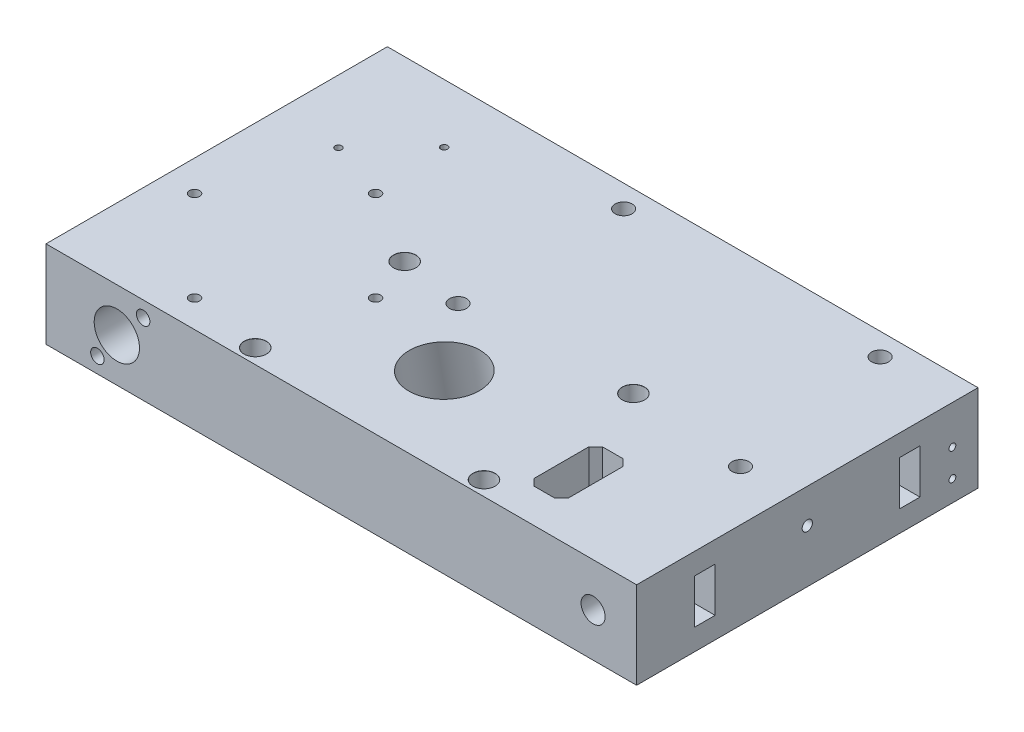
from build123d import *

# Parameters (mm, degrees)
BOSS_EXTRUDE1_DEPTH           = 12.75
BOSS_EXTRUDE1_DEPTH_BACK      = 12.75
SKETCH1_W                     = 165
SKETCH1_H                     = 100
SKETCH5_W                     = 6
SKETCH5_H                     = 13
CUT_EXTRUDE3_DEPTH            = 19.25
SKETCH6_R                     = 10.25
CUT_EXTRUDE4_DEPTH            = 105.029133509
SKETCH11_R                    = 1.5
CUT_EXTRUDE6_DEPTH            = 5
SKETCH2_R                     = 6.63
SKETCH2_R_2                   = 3.525
SKETCH2_R_3                   = 1.975
CUT_EXTRUDE7_DEPTH            = 131.264394598
SKETCH3_R                     = 2.5
CUT_EXTRUDE8_DEPTH            = 5
SKETCH12_R                    = 0.985
CUT_EXTRUDE9_DEPTH            = 5
MOVE_START                    = -12.75
MOVE_FACE1_DEPTH              = 25.5
MOVE_FACE1_2_DEPTH            = 20.5
SKETCH13_W                    = 10
SKETCH13_H                    = 20
CUT_EXTRUDE10_DEPTH           = 107.491783721
CHAMFER1_SIZE                 = 2
SKETCH14_R                    = 1.5
CUT_EXTRUDE11_DEPTH           = 5
CUT_EXTRUDE12_START           = -5
SKETCH15_R                    = 1.5
CUT_EXTRUDE12_DEPTH           = 5
CUT_EXTRUDE15_START           = -25.5
SKETCH17_R                    = 1.5
CUT_EXTRUDE15_DEPTH           = 132.991783721
SKETCH18_R                    = 1.475
SKETCH18_R_2                  = 1.5
CUT_EXTRUDE16_DEPTH           = 5
SKETCH16_R                    = 1
CUT_EXTRUDE13_DEPTH           = 10
CBORE_FOR_M3_SHCS1_AT_2_COUNT = 2
CBORE_FOR_M3_SHCS1_AT_2_PITCH = 43.77
CBORE_FOR_M3_SHCS1_AT_3_COUNT = 2
CBORE_FOR_M3_SHCS1_AT_3_PITCH = 80.030074972
CBORE_FOR_M3_SHCS1_AT_4_COUNT = 2
CBORE_FOR_M3_SHCS1_AT_4_PITCH = 67


# Read off the part's stored shape, not the designer's step: Move Face1
with BuildPart() as part:
    # Sketch1 → Boss-Extrude1 (new, two sides: drawn at the far end of the back side and taken through both)
    with BuildSketch(Plane(origin=(0, 0, 0), x_dir=(1, 0, 0), z_dir=(0, 1, 0)).offset(-BOSS_EXTRUDE1_DEPTH_BACK)):
        Rectangle(SKETCH1_W, SKETCH1_H)
    extrude(amount=BOSS_EXTRUDE1_DEPTH + BOSS_EXTRUDE1_DEPTH_BACK)

    # Sketch5 → Cut-Extrude3 (cut)
    with BuildSketch(Plane(origin=(82.5, 0, 0), x_dir=(0, 0, -1), z_dir=(1, 0, 0))):
        with Locations((-30, 0)):
            Rectangle(SKETCH5_W, SKETCH5_H)
        with Locations((30, 0)):
            Rectangle(SKETCH5_W, SKETCH5_H)
    extrude(amount=-CUT_EXTRUDE3_DEPTH, mode=Mode.SUBTRACT)

    # Sketch6 → Cut-Extrude4 (cut, through all)
    with BuildSketch(Plane(origin=(0, 20.916044041, 3.688062894), x_dir=(1, 0, 0), z_dir=(0, 0.984807753012208, 0.17364817766693072))):
        with Locations(Location((0, -21.249093385, 0), (0, 0, 270))):
            Circle(SKETCH6_R)
    extrude(amount=-CUT_EXTRUDE4_DEPTH, mode=Mode.SUBTRACT)

    # Sketch11 → Cut-Extrude6 (cut)
    with BuildSketch(Plane(origin=(0, 12.75, 0), x_dir=(1, 0, 0), z_dir=(0, 1, 0))):
        with Locations(Location((-28.466991411, -15.483495706, 0), (0, 0, 270))):
            Circle(SKETCH11_R)
        with Locations(Location((-54.983495706, -42, 0), (0, 0, 270))):
            Circle(SKETCH11_R)
        with Locations(Location((-54.983495706, 11.033008589, 0), (0, 0, 90))):
            Circle(SKETCH11_R)
        with Locations((-81.5, -15.483495706)):
            Circle(SKETCH11_R)
    extrude(amount=-CUT_EXTRUDE6_DEPTH, mode=Mode.SUBTRACT)

    # Sketch2 → Cut-Extrude7 (cut, through all)
    with BuildSketch(Plane.XY.offset(50)):
        with Locations((-69.75, 0)):
            Circle(SKETCH2_R)
        with Locations((69.75, 0)):
            Circle(SKETCH2_R_2)
        with Locations(Location((-75.45, -8.2, 0), (0, 0, 180))):
            Circle(SKETCH2_R_3)
        with Locations(Location((-62.05, 8.2, 0), (0, 0, 180))):
            Circle(SKETCH2_R_3)
    extrude(amount=-CUT_EXTRUDE7_DEPTH, mode=Mode.SUBTRACT)

    # Sketch3 → Cut-Extrude8 (cut)
    with BuildSketch(Plane(origin=(0, 12.75, 0), x_dir=(1, 0, 0), z_dir=(0, 1, 0))):
        with Locations(Location((-15, -4.8, 0), (0, 0, 270))):
            Circle(SKETCH3_R)
        with Locations(Location((67.72, -4.8, 0), (0, 0, 270))):
            Circle(SKETCH3_R)
        with Locations(Location((60.37, 43.46, 0), (0, 0, 270))):
            Circle(SKETCH3_R)
        with Locations(Location((-14.76, 43.46, 0), (0, 0, 270))):
            Circle(SKETCH3_R)
    extrude(amount=-CUT_EXTRUDE8_DEPTH, mode=Mode.SUBTRACT)

    # Sketch12 → Cut-Extrude9 (cut)
    with BuildSketch(Plane(origin=(0, 12.75, 0), x_dir=(1, 0, 0), z_dir=(0, 1, 0))):
        with Locations(Location((-56.672, 32.8, 0), (0, 0, 270))):
            Circle(SKETCH12_R)
        with Locations(Location((-72.039, 17.2, 0), (0, 0, 270))):
            Circle(SKETCH12_R)
    extrude(amount=-CUT_EXTRUDE9_DEPTH, mode=Mode.SUBTRACT)

    # Move Face1 outline → Move Face1 (add)
    with BuildSketch(Plane(origin=(0, 0, 0), x_dir=(1, 0, 0), z_dir=(0, 1, 0)).offset(MOVE_START)):
        with BuildLine():
            Line((-82.5, 50), (-90.5, 50))
            Line((-90.5, 50), (-90.5, -50))
            Line((-90.5, -50), (-82.5, -50))
            Line((-82.5, -50), (-82.5, -16.601529694))
            ThreePointArc((-82.5, -16.601529694), (-83, -15.483495706), (-82.5, -14.365461717))
            Line((-82.5, -14.365461717), (-82.5, 50))
        make_face()
    extrude(amount=MOVE_FACE1_DEPTH)

    # Move Face1 2 outline → Move Face1 2 (add)
    with BuildSketch(Plane(origin=(0, 0, 0), x_dir=(1, 0, 0), z_dir=(0, 1, 0)).offset(MOVE_START)):
        with BuildLine():
            Line((-82.5, -16.601529694), (-82.5, -14.365461717))
            ThreePointArc((-82.5, -14.365461717), (-83, -15.483495706), (-82.5, -16.601529694))
        make_face()
    extrude(amount=MOVE_FACE1_2_DEPTH)

    # Sketch13 → Cut-Extrude10 (cut, through all)
    with BuildSketch(Plane(origin=(0, 12.75, 0), x_dir=(1, 0, 0), z_dir=(0, 1, 0))):
        with Locations((45.5, -30)):
            Rectangle(SKETCH13_W, SKETCH13_H)
    extrude(amount=-CUT_EXTRUDE10_DEPTH, mode=Mode.SUBTRACT)

    # Chamfer1
    chamfer1_edges = [part.edges().sort_by_distance(p)[0] for p in [
        (40.5, 0, 40),
        (40.5, 0, 20),
        (50.5, 0, 20),
        (50.5, 0, 40),
    ]]
    chamfer(chamfer1_edges, length=CHAMFER1_SIZE)

    # Sketch14 → Cut-Extrude11 (cut)
    with BuildSketch(Plane(origin=(82.5, 0, 0), x_dir=(0, 0, -1), z_dir=(1, 0, 0))):
        with Locations((0, 2.75)):
            Circle(SKETCH14_R)
    extrude(amount=-CUT_EXTRUDE11_DEPTH, mode=Mode.SUBTRACT)

    # Sketch15 → Cut-Extrude12 (cut)
    with BuildSketch(Plane.ZY.offset(90.5).offset(CUT_EXTRUDE12_START)):
        with Locations(Location((0, 2.75, 0), (0, 0, 180))):
            Circle(SKETCH15_R)
    extrude(amount=CUT_EXTRUDE12_DEPTH, mode=Mode.SUBTRACT)

    # Sketch17 → Cut-Extrude15 (cut, through all)
    with BuildSketch(Plane(origin=(0, 12.75, 0), x_dir=(1, 0, 0), z_dir=(0, 1, 0)).offset(CUT_EXTRUDE15_START)):
        with Locations(Location((33.5, -1.940063906, 0), (0, 0, 90))):
            Circle(SKETCH17_R)
        with Locations(Location((33.5, -45.710063906, 0), (0, 0, 90))):
            Circle(SKETCH17_R)
        with Locations(Location((-33.5, -45.710063906, 0), (0, 0, 90))):
            Circle(SKETCH17_R)
        with Locations(Location((-33.5, -1.940063906, 0), (0, 0, 90))):
            Circle(SKETCH17_R)
    extrude(amount=CUT_EXTRUDE15_DEPTH, mode=Mode.SUBTRACT)

    # Sketch18 → Cut-Extrude16 (cut)
    with BuildSketch(Plane.XZ.offset(12.75)):
        with Locations(Location((31, -38.46, 0), (0, 0, 270))):
            Circle(SKETCH18_R)
        with Locations(Location((72, -21, 0), (0, 0, 270))):
            Circle(SKETCH18_R_2)
        with Locations(Location((72, -41, 0), (0, 0, 90))):
            Circle(SKETCH18_R_2)
        with Locations(Location((-10, -21, 0), (0, 0, 90))):
            Circle(SKETCH18_R_2)
        with Locations(Location((-10, -41, 0), (0, 0, 270))):
            Circle(SKETCH18_R_2)
    extrude(amount=-CUT_EXTRUDE16_DEPTH, mode=Mode.SUBTRACT)

    # Sketch16 → Cut-Extrude13 (cut)
    with BuildSketch(Plane(origin=(82.5, 0, 0), x_dir=(0, 0, -1), z_dir=(1, 0, 0))):
        with Locations((42.508182421, -6.590003662)):
            Circle(SKETCH16_R)
        with Locations((42.508182421, 1.409996338)):
            Circle(SKETCH16_R)
    extrude(amount=-CUT_EXTRUDE13_DEPTH, mode=Mode.SUBTRACT)

    # Sketch22 → CBORE for M3 SHCS1 (revolve, cut)
    with BuildSketch(Plane(origin=(33.5, 12.75, 1.940063906), x_dir=(0, 0, 1), z_dir=(1, 0, 0))):
        Polygon((0, 0), (0, 25.5), (1.8, 25.5), (1.8, 20), (3.25, 20), (3.25, 0.025), (3.275, 0), align=None)
    cbore_for_m3_shcs1 = revolve(axis=Axis((33.5, 19.1, 1.940063906), (0, -1, 0)), mode=Mode.SUBTRACT)

    # CBORE for M3 SHCS1 at 2: CBORE for M3 SHCS1 ×2
    with Locations(*[(0, 0, i * CBORE_FOR_M3_SHCS1_AT_2_PITCH) for i in range(1, CBORE_FOR_M3_SHCS1_AT_2_COUNT)]):
        add(cbore_for_m3_shcs1, mode=Mode.SUBTRACT)

    # CBORE for M3 SHCS1 at 3: CBORE for M3 SHCS1 ×2
    with Locations(*[Vector(-0.8371852709567797, 0, 0.5469193926832577) * (i * CBORE_FOR_M3_SHCS1_AT_3_PITCH) for i in range(1, CBORE_FOR_M3_SHCS1_AT_3_COUNT)]):
        add(cbore_for_m3_shcs1, mode=Mode.SUBTRACT)

    # CBORE for M3 SHCS1 at 4: CBORE for M3 SHCS1 ×2
    with Locations(*[(-i * CBORE_FOR_M3_SHCS1_AT_4_PITCH, 0, 0) for i in range(1, CBORE_FOR_M3_SHCS1_AT_4_COUNT)]):
        add(cbore_for_m3_shcs1, mode=Mode.SUBTRACT)


solid = part.part
